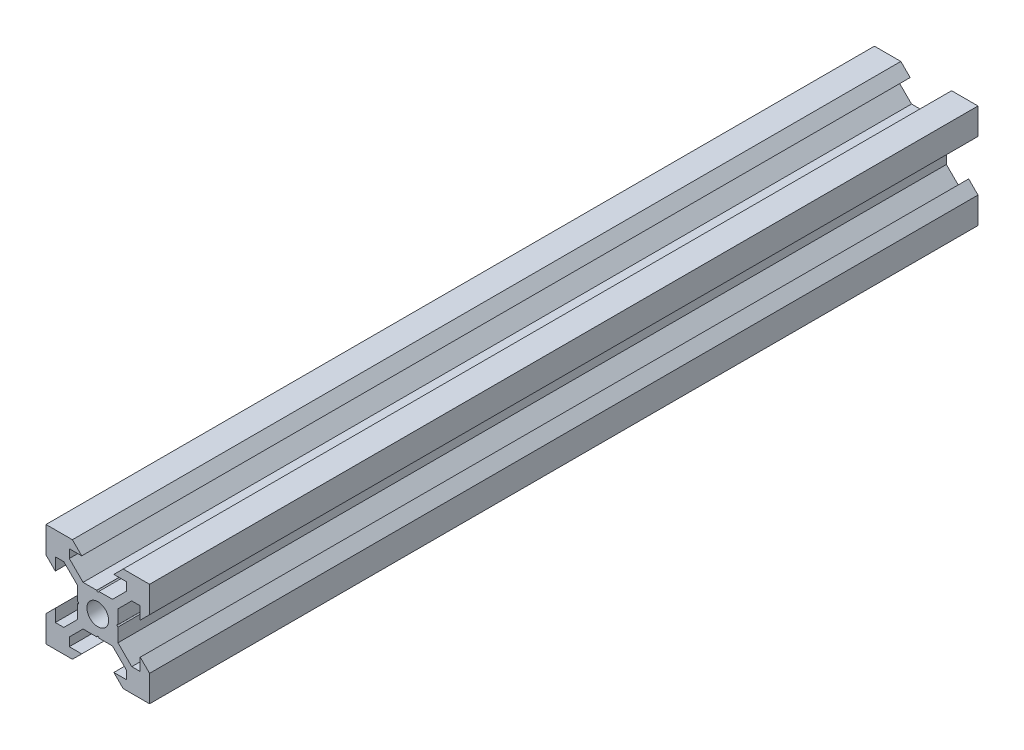
from build123d import *

# Parameters (mm, degrees)
SKETCH1_R           = 2.1
BOSS_EXTRUDE1_DEPTH = 160
CUT_EXTRUDE1_DEPTH  = 160


# Read off the part's stored shape, not the designer's step: Cut-Extrude1
with BuildPart() as part:
    # Sketch1 → Boss-Extrude1 (new body)
    with BuildSketch(Plane.XY):
        Polygon((-10, -4.9), (-10, -10), (-4.9, -10), (-3.1, -8.2), (-5.499339828, -8.2), (-5.499339828, -6.56), (-2.84, -3.900660172), (2.84, -3.900660172), (5.499339828, -6.56), (5.499339828, -8.2), (3.1, -8.2), (4.9, -10), (10, -10), (10, -4.9), (8.2, -3.1), (8.2, -5.499339828), (6.56, -5.499339828), (3.900660172, -2.84), (3.900660172, 2.84), (6.56, 5.499339828), (8.2, 5.499339828), (8.2, 3.1), (10, 4.9), (10, 10), (4.9, 10), (3.1, 8.2), (5.499339828, 8.2), (5.499339828, 6.56), (2.84, 3.900660172), (-2.84, 3.900660172), (-5.499339828, 6.56), (-5.499339828, 8.2), (-3.1, 8.2), (-4.9, 10), (-10, 10), (-10, 4.9), (-8.2, 3.1), (-8.2, 5.499339828), (-6.56, 5.499339828), (-3.900660172, 2.84), (-3.900660172, -2.84), (-6.56, -5.499339828), (-8.2, -5.499339828), (-8.2, -3.1), align=None)
        Circle(SKETCH1_R, mode=Mode.SUBTRACT)
    extrude(amount=BOSS_EXTRUDE1_DEPTH)

    # Cut-Extrude1 outline → Cut-Extrude1 (cut)
    with BuildSketch(Plane.XY):
        with BuildLine():
            ThreePointArc((-3.900660172, -0.2), (-3.700660172, 0), (-3.900660172, 0.2))
            Line((-3.900660172, 0.2), (-3.900660172, -0.2))
        make_face()
        with BuildLine():
            ThreePointArc((-0.2, 3.900660172), (0, 3.700660172), (0.2, 3.900660172))
            Line((0.2, 3.900660172), (-0.2, 3.900660172))
        make_face()
        with BuildLine():
            ThreePointArc((3.900660172, 0.2), (3.700660172, 0), (3.900660172, -0.2))
            Line((3.900660172, -0.2), (3.900660172, 0.2))
        make_face()
        with BuildLine():
            ThreePointArc((0.2, -3.900660172), (0, -3.700660172), (-0.2, -3.900660172))
            Line((-0.2, -3.900660172), (0.2, -3.900660172))
        make_face()
    extrude(amount=CUT_EXTRUDE1_DEPTH, mode=Mode.SUBTRACT)


solid = part.part
